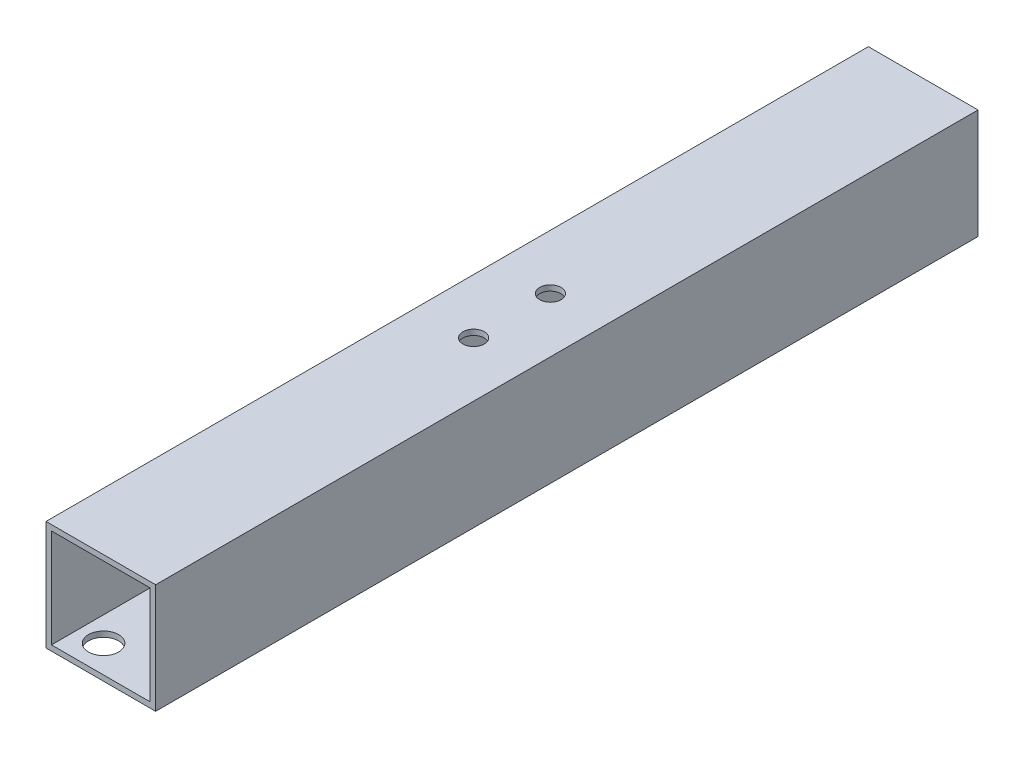
from build123d import *

# Parameters (mm, degrees)
SKETCH_1_W          = 20
SKETCH_1_H          = 20
SKETCH_1_W_2        = 18
SKETCH_1_H_2        = 18
EXTRUDE_1_DEPTH     = 150
SKETCH_3_R          = 1.95
CUT_EXTRUDE_2_DEPTH = 153.643375225
CUT_EXTRUDE_3_REACH = 154.643
SKETCH_4_R          = 2.75


with BuildPart() as part:
    # 草图1 → 拉伸-薄壁1 (new body)
    with BuildSketch(Plane.XY):
        with Locations((10, -10)):
            Rectangle(SKETCH_1_W, SKETCH_1_H)
        with Locations((10, -10)):
            Rectangle(SKETCH_1_W_2, SKETCH_1_H_2, mode=Mode.SUBTRACT)
    extrude(amount=EXTRUDE_1_DEPTH)

    # 草图3 → 切除-拉伸2 (cut, through all)
    with BuildSketch(Plane.XZ.offset(20)):
        with Locations((10, 82)):
            Circle(SKETCH_3_R)
        with Locations((10, 68)):
            Circle(SKETCH_3_R)
    extrude(amount=-CUT_EXTRUDE_2_DEPTH, mode=Mode.SUBTRACT)

    # 草图4 → 切除-拉伸3 (cut, up to next)
    with BuildSketch(Plane.XZ.offset(20), mode=Mode.PRIVATE) as cut_extrude_3_sk1:
        with Locations((5.5, 145)):
            Circle(SKETCH_4_R)
    cut_extrude_3_tool1 = extrude(cut_extrude_3_sk1.sketch, amount=-CUT_EXTRUDE_3_REACH, mode=Mode.PRIVATE) & part.part
    # 草图4 → 切除-拉伸3 (cut, up to next)
    with BuildSketch(Plane.XZ.offset(20), mode=Mode.PRIVATE) as cut_extrude_3_sk2:
        with Locations((5.5, 5)):
            Circle(SKETCH_4_R)
    cut_extrude_3_tool2 = extrude(cut_extrude_3_sk2.sketch, amount=-CUT_EXTRUDE_3_REACH, mode=Mode.PRIVATE) & part.part
    add(cut_extrude_3_tool1.solids().sort_by_distance((5.5, -20, 145))[0], mode=Mode.SUBTRACT)
    add(cut_extrude_3_tool2.solids().sort_by_distance((5.5, -20, 5))[0], mode=Mode.SUBTRACT)


solid = part.part
